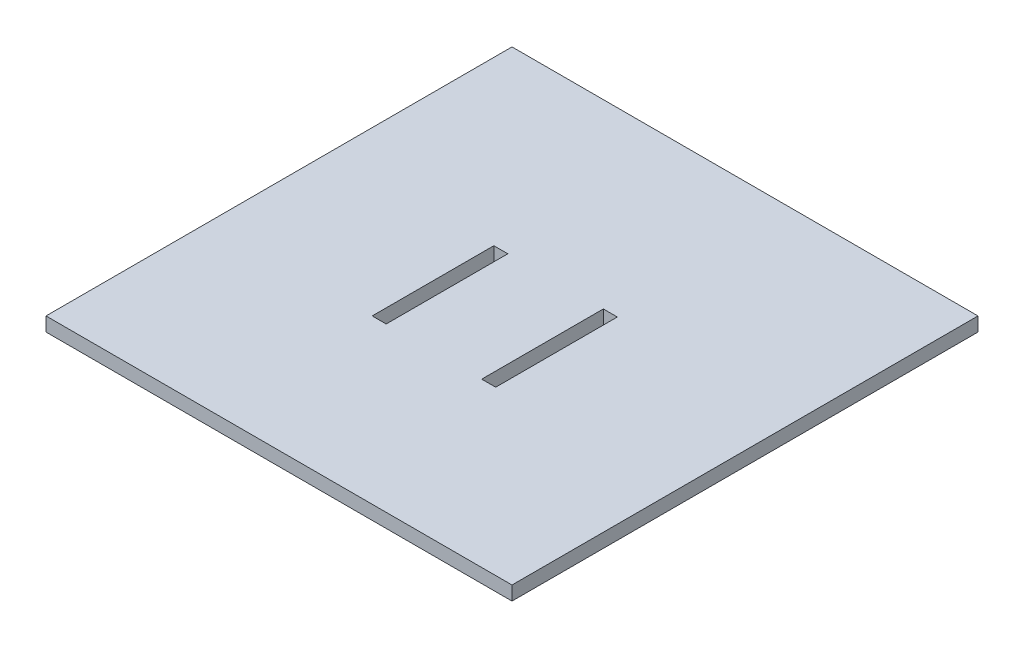
from build123d import *

# Parameters (mm, degrees)
BAIXOBASEESB_W           = 100
BAIXOBASEESB_H           = 100
BAIXOBASEESB_W_2         = 3
BAIXOBASEESB_H_2         = 26.1
RESSALTO_EXTRUS_O1_DEPTH = 3


with BuildPart() as part:
    # BaixoBaseEsb → Ressalto-extrusão1 (new body)
    with BuildSketch(Plane(origin=(0, 0, 0), x_dir=(1, 0, 0), z_dir=(0, 1, 0))):
        with Locations((50, 50)):
            Rectangle(BAIXOBASEESB_W, BAIXOBASEESB_H)
        with Locations((36.5, 48.05)):
            Rectangle(BAIXOBASEESB_W_2, BAIXOBASEESB_H_2, mode=Mode.SUBTRACT)
        with Locations((60, 48.05)):
            Rectangle(BAIXOBASEESB_W_2, BAIXOBASEESB_H_2, mode=Mode.SUBTRACT)
    extrude(amount=RESSALTO_EXTRUS_O1_DEPTH)


solid = part.part
